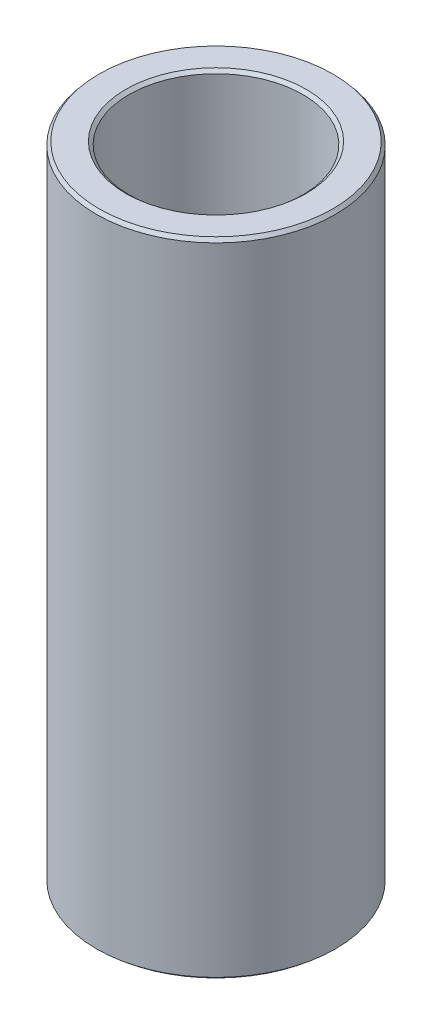
from build123d import *
from OCP.BRepFilletAPI import BRepFilletAPI_MakeChamfer

# Parameters (mm, degrees)
SKETCH1_R           = 35
BOSS_EXTRUDE1_DEPTH = 187.842386874
SKETCH2_R           = 25.418125269
CUT_EXTRUDE1_DEPTH  = 195.254375258
CHAMFER1_SIZE       = 0.974617213
CHAMFER1_SIZE2      = 0.828744512


with BuildPart() as part:
    # Sketch1 → Boss-Extrude1 (new body)
    with BuildSketch(Plane(origin=(0, 0, 0), x_dir=(1, 0, 0), z_dir=(0, 1, 0))):
        Circle(SKETCH1_R)
    extrude(amount=BOSS_EXTRUDE1_DEPTH)

    # Sketch2 → Cut-Extrude1 (cut, through all)
    with BuildSketch(Plane(origin=(0, 0, 0), x_dir=(1, 0, 0), z_dir=(0, 1, 0))):
        Circle(SKETCH2_R)
    extrude(amount=CUT_EXTRUDE1_DEPTH, mode=Mode.SUBTRACT)

    # Chamfer1: one chamfer whose edges measure the first distance from different faces: ONE call of the kernel's chamfer builder (chamfer() names one face for all edges)
    chamfer1_edges_1 = [part.edges().sort_by_distance(p)[0] for p in [
        (-25.418125269, 187.842386874, 0),
    ]]
    chamfer1_side_1 = [part.faces().sort_by_distance(p)[0] for p in [
        (-34.010050506, 187.842386874, 0),
    ]]
    chamfer1_edges_2 = [part.edges().sort_by_distance(p)[0] for p in [
        (-25.418125269, 0, 0),
    ]]
    chamfer1_side_2 = [part.faces().sort_by_distance(p)[0] for p in [
        (-25.418125269, 93.921193437, 0),
    ]]
    chamfer1_edges_3 = [part.edges().sort_by_distance(p)[0] for p in [
        (-35, 0, 0),
    ]]
    chamfer1_side_3 = [part.faces().sort_by_distance(p)[0] for p in [
        (-34.010050506, 0, 0),
    ]]
    chamfer1_edges_4 = [part.edges().sort_by_distance(p)[0] for p in [
        (-35, 187.842386874, 0),
    ]]
    chamfer1_side_4 = [part.faces().sort_by_distance(p)[0] for p in [
        (-35, 93.921193437, 0),
    ]]
    chamfer1 = BRepFilletAPI_MakeChamfer(part.part.solid().wrapped)
    for e in chamfer1_edges_1:
        chamfer1.Add(CHAMFER1_SIZE, CHAMFER1_SIZE2, e.wrapped, chamfer1_side_1[0].wrapped)  # the first distance lies on this face
    for e in chamfer1_edges_2:
        chamfer1.Add(CHAMFER1_SIZE, CHAMFER1_SIZE2, e.wrapped, chamfer1_side_2[0].wrapped)  # the first distance lies on this face
    for e in chamfer1_edges_3:
        chamfer1.Add(CHAMFER1_SIZE, CHAMFER1_SIZE2, e.wrapped, chamfer1_side_3[0].wrapped)  # the first distance lies on this face
    for e in chamfer1_edges_4:
        chamfer1.Add(CHAMFER1_SIZE, CHAMFER1_SIZE2, e.wrapped, chamfer1_side_4[0].wrapped)  # the first distance lies on this face
    add(Compound.cast(chamfer1.Shape()), mode=Mode.REPLACE)


solid = part.part
